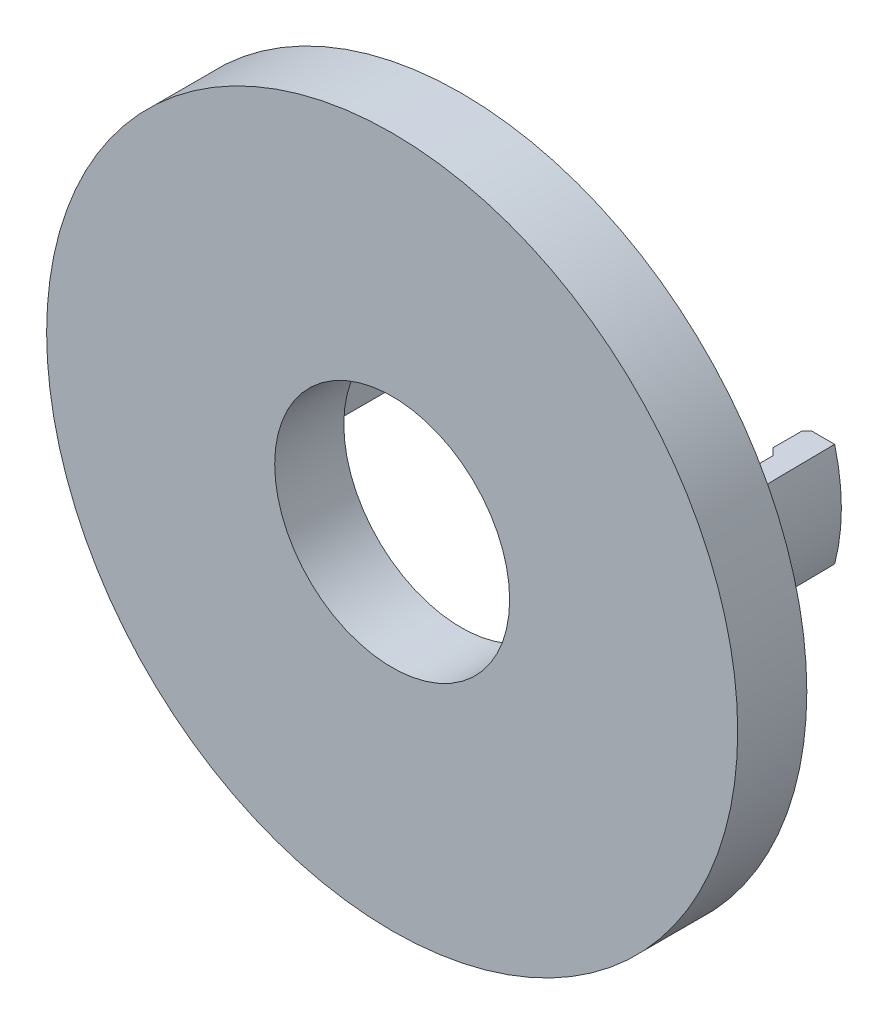
from build123d import *

# Parameters (mm, degrees)
GUARD_BASE_R           = 25
GUARD_DEPTH            = 5
INNER_AXLE_HOLE_BASE_R = 8.5
INNER_AXLE_HOLE_DEPTH  = 36.707142143
COUPLING_TOOTH_DEPTH   = 3.75


with BuildPart() as part:
    # Guard base → Guard (new body)
    with BuildSketch(Plane.XY):
        Circle(GUARD_BASE_R)
    extrude(amount=GUARD_DEPTH)

    # Inner axle hole base → Inner axle hole (cut, through all)
    with BuildSketch(Plane.XY.offset(5)):
        Circle(INNER_AXLE_HOLE_BASE_R)
    extrude(amount=-INNER_AXLE_HOLE_DEPTH, mode=Mode.SUBTRACT)

    # Coupling tooth base → Coupling tooth (add, symmetric)
    with BuildSketch(Plane(origin=(0, 0, 0), x_dir=(1, 0, 0), z_dir=(0, 1, 0))):
        Polygon((15.5, 12.75), (12.603553391, 12.75), (12.25, 12.396446609), (12.25, 10.310660172), (12.75, 9.810660172), (12.75, 2.396446609), (10.353553391, 0), (15.5, 0), align=None)
    coupling_tooth = extrude(amount=COUPLING_TOOTH_DEPTH, both=True)

    # Sketch6<4> → Circularity cut (revolve, cut)
    with BuildSketch(Plane(origin=(0, 0, 0), x_dir=(1, 0, 0), z_dir=(0, 1, 0))):
        with BuildLine():
            add(Edge.make_bspline(
                [(14.75, 12.75), (14.75, 3.446446626), (15.5, 0)],
                knots=[0, 0, 0, 1, 1, 1], degree=2))
            Line((15.5, 0), (25, 0))
            Line((25, 0), (25, 12.75))
            Line((25, 12.75), (14.75, 12.75))
        make_face()
    circularity_cut = revolve(axis=Axis((0, 0, 0), (0, 0, -1)), mode=Mode.SUBTRACT)

    # Coutpling teeth: Coupling tooth, Circularity cut across plane
    add(coupling_tooth.mirror(Plane(origin=(0, 0, 0), x_dir=(0, 0, 1), z_dir=(1, 0, 0))))
    add(circularity_cut.mirror(Plane(origin=(0, 0, 0), x_dir=(0, 0, 1), z_dir=(1, 0, 0))), mode=Mode.SUBTRACT)


solid = part.part
